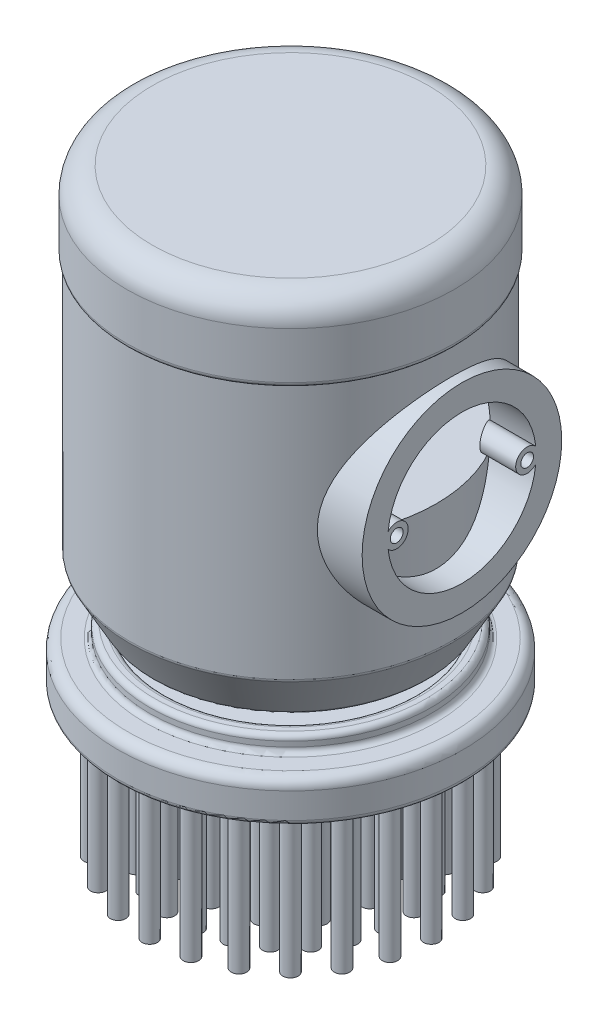
from build123d import *

# Parameters (mm, degrees)
SKETCH1_W                = 1.5
SKETCH1_H                = 3
SKETCH2_R                = 24.5
SKETCH2_R_2              = 13
CUT_EXTRUDE2_DEPTH       = 2
SKETCH5_R                = 19.5
BOSS_EXTRUDE3_DEPTH      = 33.5
SKETCH7_R                = 28.5
CUT_EXTRUDE3_DEPTH       = 43
SKETCH3_R                = 32
BOSS_EXTRUDE1_DEPTH      = 15
SKETCH4_R                = 1.5
BOSS_EXTRUDE2_DEPTH      = 29
FILLET1_R                = 5
FILLET2_R                = 1
FILLET3_R                = 2
CUT_EXTRUDE4_REACH       = 107.535
CUT_EXTRUDE4_END_RADIUS  = 28.5
SKETCH6_R                = 14.5
BOSS_EXTRUDE5_REACH      = 107.535
BOSS_EXTRUDE5_END_RADIUS = 28.5
SKETCH10_R               = 2.25
SKETCH10_R_2             = 1.25


with BuildPart() as part:
    # Sketch1 → Revolve1 (revolve)
    with BuildSketch(Plane.XY, mode=Mode.PRIVATE) as revolve1_sk:
        Polygon((1.5, 0), (26.5, 0), (31.5, 9), (31.5, 74), (0, 74), (0, 0), align=None)
        with Locations((0.75, -1.5)):
            Rectangle(SKETCH1_W, SKETCH1_H)
        Polygon((27.5, -3), (1.5, -3), (0, -3), (0, -6), (27.5, -6), align=None)
        Polygon((27.5, -6), (0, -6), (0, -14), (33.75, -14), (33.75, -6), align=None)
    revolve(revolve1_sk.sketch.rotate(Axis((0, 0, 0), (0, 1, 0)), 90), axis=Axis((0, 0, 0), (0, 1, 0)))

    # Sketch2 → Cut-Extrude2 (cut)
    with BuildSketch(Plane(origin=(0, -3, 0), x_dir=(1, 0, 0), z_dir=(0, 1, 0))):
        with Locations(Location((0, 0, 0), (0, 0, 270))):
            Circle(SKETCH2_R)
        with Locations(Location((0, 0, 0), (0, 0, 270))):
            Circle(SKETCH2_R_2, mode=Mode.SUBTRACT)
    extrude(amount=-CUT_EXTRUDE2_DEPTH, mode=Mode.SUBTRACT)

    # Sketch5 → Boss-Extrude3 (add)
    with BuildSketch(Plane(origin=(0, 0, 0), x_dir=(0, 0, -1), z_dir=(1, 0, 0))):
        with Locations(Location((0, 34.5, 0), (0, 0, 180))):
            Circle(SKETCH5_R)
    extrude(amount=BOSS_EXTRUDE3_DEPTH)

    # Sketch7 → Cut-Extrude3 (cut)
    with BuildSketch(Plane(origin=(0, 74, 0), x_dir=(1, 0, 0), z_dir=(0, 1, 0))):
        with Locations(Location((0, 0, 0), (0, 0, 270))):
            Circle(SKETCH7_R)
    extrude(amount=-CUT_EXTRUDE3_DEPTH, mode=Mode.SUBTRACT)

    # Sketch3 → Boss-Extrude1 (add)
    with BuildSketch(Plane(origin=(0, 74, 0), x_dir=(1, 0, 0), z_dir=(0, 1, 0))):
        with Locations(Location((0, 0, 0), (0, 0, 270))):
            Circle(SKETCH3_R)
    extrude(amount=-BOSS_EXTRUDE1_DEPTH)

    # Sketch4 → Boss-Extrude2 (add)
    with BuildSketch(Plane.XZ.offset(14)):
        with Locations(Location((27.5, 0, 0), (0, 0, 90))):
            Circle(SKETCH4_R)
        with Locations(Location((26.562960223, 7.11752374, 0), (0, 0, 90))):
            Circle(SKETCH4_R)
        with Locations(Location((23.815698604, 13.75, 0), (0, 0, 90))):
            Circle(SKETCH4_R)
        with Locations(Location((19.445436483, 19.445436483, 0), (0, 0, 90))):
            Circle(SKETCH4_R)
        with Locations(Location((13.75, 23.815698604, 0), (0, 0, 90))):
            Circle(SKETCH4_R)
        with Locations(Location((7.11752374, 26.562960223, 0), (0, 0, 90))):
            Circle(SKETCH4_R)
        with Locations(Location((0, 27.5, 0), (0, 0, 90))):
            Circle(SKETCH4_R)
        with Locations(Location((-7.11752374, 26.562960223, 0), (0, 0, 90))):
            Circle(SKETCH4_R)
        with Locations(Location((-13.75, 23.815698604, 0), (0, 0, 90))):
            Circle(SKETCH4_R)
        with Locations(Location((-19.445436483, 19.445436483, 0), (0, 0, 90))):
            Circle(SKETCH4_R)
        with Locations(Location((-23.815698604, 13.75, 0), (0, 0, 90))):
            Circle(SKETCH4_R)
        with Locations(Location((-26.562960223, 7.11752374, 0), (0, 0, 90))):
            Circle(SKETCH4_R)
        with Locations(Location((-27.5, 0, 0), (0, 0, 90))):
            Circle(SKETCH4_R)
        with Locations(Location((-26.562960223, -7.11752374, 0), (0, 0, 90))):
            Circle(SKETCH4_R)
        with Locations(Location((-23.815698604, -13.75, 0), (0, 0, 90))):
            Circle(SKETCH4_R)
        with Locations(Location((-19.445436483, -19.445436483, 0), (0, 0, 90))):
            Circle(SKETCH4_R)
        with Locations(Location((-13.75, -23.815698604, 0), (0, 0, 90))):
            Circle(SKETCH4_R)
        with Locations(Location((0, -27.5, 0), (0, 0, 90))):
            Circle(SKETCH4_R)
        with Locations(Location((7.11752374, -26.562960223, 0), (0, 0, 90))):
            Circle(SKETCH4_R)
        with Locations(Location((13.75, -23.815698604, 0), (0, 0, 90))):
            Circle(SKETCH4_R)
        with Locations(Location((19.445436483, -19.445436483, 0), (0, 0, 90))):
            Circle(SKETCH4_R)
        with Locations(Location((23.815698604, -13.75, 0), (0, 0, 90))):
            Circle(SKETCH4_R)
        with Locations(Location((26.562960223, -7.11752374, 0), (0, 0, 90))):
            Circle(SKETCH4_R)
        with Locations(Location((-2.806313133, 21.31606452, 0), (0, 0, 90))):
            Circle(SKETCH4_R)
        with Locations(Location((-8.227693796, 19.863409949, 0), (0, 0, 90))):
            Circle(SKETCH4_R)
        with Locations(Location((-13.088370724, 17.057096816, 0), (0, 0, 90))):
            Circle(SKETCH4_R)
        with Locations(Location((-17.057096816, 13.088370724, 0), (0, 0, 90))):
            Circle(SKETCH4_R)
        with Locations(Location((-19.863409949, 8.227693796, 0), (0, 0, 90))):
            Circle(SKETCH4_R)
        with Locations(Location((-21.31606452, 2.806313133, 0), (0, 0, 90))):
            Circle(SKETCH4_R)
        with Locations(Location((-21.31606452, -2.806313133, 0), (0, 0, 90))):
            Circle(SKETCH4_R)
        with Locations(Location((-19.863409949, -8.227693796, 0), (0, 0, 90))):
            Circle(SKETCH4_R)
        with Locations(Location((-17.057096816, -13.088370724, 0), (0, 0, 90))):
            Circle(SKETCH4_R)
        with Locations(Location((-13.088370724, -17.057096816, 0), (0, 0, 90))):
            Circle(SKETCH4_R)
        with Locations(Location((-8.227693796, -19.863409949, 0), (0, 0, 90))):
            Circle(SKETCH4_R)
        with Locations(Location((-2.806313133, -21.31606452, 0), (0, 0, 90))):
            Circle(SKETCH4_R)
        with Locations(Location((2.806313133, -21.31606452, 0), (0, 0, 90))):
            Circle(SKETCH4_R)
        with Locations(Location((8.227693796, -19.863409949, 0), (0, 0, 90))):
            Circle(SKETCH4_R)
        with Locations(Location((17.057096816, -13.088370724, 0), (0, 0, 90))):
            Circle(SKETCH4_R)
        with Locations(Location((21.31606452, -2.806313133, 0), (0, 0, 90))):
            Circle(SKETCH4_R)
        with Locations(Location((21.31606452, 2.806313133, 0), (0, 0, 90))):
            Circle(SKETCH4_R)
        with Locations(Location((19.863409949, 8.227693796, 0), (0, 0, 90))):
            Circle(SKETCH4_R)
        with Locations(Location((8.227693796, 19.863409949, 0), (0, 0, 90))):
            Circle(SKETCH4_R)
        with BuildLine():
            ThreePointArc((4.306313133, 21.31606452), (2.904417827, 22.812852904), (1.319145841, 21.511853808))
            Line((1.319145841, 21.511853808), (2.806313133, 21.31606452))
            Line((2.806313133, 21.31606452), (4.293480425, 21.120275231))
            ThreePointArc((4.293480425, 21.120275231), (4.303101518, 21.217959826), (4.306313133, 21.31606452))
        make_face()
        with BuildLine():
            Line((2.806313133, 21.31606452), (1.319145841, 21.511853808))
            ThreePointArc((1.319145841, 21.511853808), (2.610523844, 19.828897227), (4.293480425, 21.120275231))
            Line((4.293480425, 21.120275231), (2.806313133, 21.31606452))
        make_face()
        with Locations(Location((0, 15.5, 0), (0, 0, 90))):
            Circle(SKETCH4_R)
        with Locations(Location((4.011695199, 14.971850307, 0), (0, 0, 90))):
            Circle(SKETCH4_R)
        with Locations(Location((7.75, 13.423393759, 0), (0, 0, 90))):
            Circle(SKETCH4_R)
        with Locations(Location((10.960155108, 10.960155108, 0), (0, 0, 90))):
            Circle(SKETCH4_R)
        with Locations(Location((13.423393759, 7.75, 0), (0, 0, 90))):
            Circle(SKETCH4_R)
        with Locations(Location((14.971850307, 4.011695199, 0), (0, 0, 90))):
            Circle(SKETCH4_R)
        with Locations(Location((15.5, 0, 0), (0, 0, 90))):
            Circle(SKETCH4_R)
        with Locations(Location((14.971850307, -4.011695199, 0), (0, 0, 90))):
            Circle(SKETCH4_R)
        with Locations(Location((13.423393759, -7.75, 0), (0, 0, 90))):
            Circle(SKETCH4_R)
        with Locations(Location((10.960155108, -10.960155108, 0), (0, 0, 90))):
            Circle(SKETCH4_R)
        with Locations(Location((4.011695199, -14.971850307, 0), (0, 0, 90))):
            Circle(SKETCH4_R)
        with Locations(Location((0, -15.5, 0), (0, 0, 90))):
            Circle(SKETCH4_R)
        with Locations(Location((-4.011695199, -14.971850307, 0), (0, 0, 90))):
            Circle(SKETCH4_R)
        with Locations(Location((-7.75, -13.423393759, 0), (0, 0, 90))):
            Circle(SKETCH4_R)
        with Locations(Location((-10.960155108, -10.960155108, 0), (0, 0, 90))):
            Circle(SKETCH4_R)
        with Locations(Location((-13.423393759, -7.75, 0), (0, 0, 90))):
            Circle(SKETCH4_R)
        with Locations(Location((-14.971850307, -4.011695199, 0), (0, 0, 90))):
            Circle(SKETCH4_R)
        with Locations(Location((-15.5, 0, 0), (0, 0, 90))):
            Circle(SKETCH4_R)
        with Locations(Location((-4.011695199, 14.971850307, 0), (0, 0, 90))):
            Circle(SKETCH4_R)
        with Locations(Location((-7.75, 13.423393759, 0), (0, 0, 90))):
            Circle(SKETCH4_R)
        with Locations(Location((-10.960155108, 10.960155108, 0), (0, 0, 90))):
            Circle(SKETCH4_R)
        with Locations(Location((-13.423393759, 7.75, 0), (0, 0, 90))):
            Circle(SKETCH4_R)
        with Locations(Location((-14.971850307, 4.011695199, 0), (0, 0, 90))):
            Circle(SKETCH4_R)
        with Locations(Location((-7.11752374, -26.562960223, 0), (0, 0, 90))):
            Circle(SKETCH4_R)
        with Locations(Location((13.088370724, -17.057096816, 0), (0, 0, 90))):
            Circle(SKETCH4_R)
        with Locations(Location((19.863409949, -8.227693796, 0), (0, 0, 90))):
            Circle(SKETCH4_R)
        with Locations(Location((17.057096816, 13.088370724, 0), (0, 0, 90))):
            Circle(SKETCH4_R)
        with Locations(Location((13.088370724, 17.057096816, 0), (0, 0, 90))):
            Circle(SKETCH4_R)
        with Locations(Location((7.75, -13.423393759, 0), (0, 0, 90))):
            Circle(SKETCH4_R)
    extrude(amount=BOSS_EXTRUDE2_DEPTH)

    # Fillet1
    fillet1_edges = [part.edges().sort_by_distance(p)[0] for p in [
        (0, 74, -32),
    ]]
    fillet(fillet1_edges, radius=FILLET1_R)

    # Fillet2
    # the kernel refuses this fillet: 1 mm, written as the material it adds along each edge
    with BuildSketch(Plane(origin=(0, -6, 0), x_dir=(0, 0, -1), z_dir=(1, 0, 0))) as fillet2_piece_1:
        with BuildLine():
            CenterArc((27.5 + FILLET2_R, FILLET2_R), FILLET2_R, 180, 90)
            Line((27.5 + FILLET2_R, 0), (27.5, 0))
            Line((27.5, 0), (27.5, FILLET2_R))
        make_face()
    revolve(axis=Axis((0, -6, 0), (0, 1, 0)))
    # the kernel refuses this fillet: 1 mm, written as the material it takes off along each edge
    with BuildSketch(Plane(origin=(0, 0, 0), x_dir=(0, 0, -1), z_dir=(1, 0, 0))) as fillet2_2_piece_1:
        with BuildLine():
            CenterArc((26.5 - FILLET2_R * 0.588403348999, FILLET2_R), FILLET2_R, 270, 60.945395901)
            Line((26.5 - FILLET2_R * 0.588403348999, 0), (26.5, 0))
            Line((26.5, 0), (26.5 + FILLET2_R * 0.285753927123, FILLET2_R * 0.514357068821))
        make_face()
    revolve(axis=Axis((0, 0, 0), (0, 1, 0)), mode=Mode.SUBTRACT)
    with BuildSketch(Plane(origin=(0, -3, 0), x_dir=(0, 0, -1), z_dir=(1, 0, 0))) as fillet2_2_piece_2:
        with BuildLine():
            CenterArc((27.5 - FILLET2_R, -FILLET2_R), FILLET2_R, 0, 90)
            Line((27.5, -FILLET2_R), (27.5, 0))
            Line((27.5, 0), (27.5 - FILLET2_R, 0))
        make_face()
    revolve(axis=Axis((0, -3, 0), (0, 1, 0)), mode=Mode.SUBTRACT)
    with BuildSketch(Plane(origin=(0, -14, 0), x_dir=(0, 0, -1), z_dir=(1, 0, 0))) as fillet2_2_piece_3:
        with BuildLine():
            CenterArc((33.75 - FILLET2_R, FILLET2_R), FILLET2_R, 270, 90)
            Line((33.75 - FILLET2_R, 0), (33.75, 0))
            Line((33.75, 0), (33.75, FILLET2_R))
        make_face()
    revolve(axis=Axis((0, -14, 0), (0, 1, 0)), mode=Mode.SUBTRACT)
    with BuildSketch(Plane(origin=(0, 9, 0), x_dir=(0, 0, -1), z_dir=(1, 0, 0))) as fillet2_2_piece_4:
        with BuildLine():
            CenterArc((31.5 - FILLET2_R, FILLET2_R * 0.259126028197), FILLET2_R, 330.945395901, 29.054604099)
            Line((31.5 - FILLET2_R * 0.125842723878, -FILLET2_R * 0.226516902981), (31.5, 0))
            Line((31.5, 0), (31.5, FILLET2_R * 0.259126028197))
        make_face()
    revolve(axis=Axis((0, 9, 0), (0, 1, 0)), mode=Mode.SUBTRACT)
    with BuildSketch(Plane(origin=(0, -3, 0), x_dir=(0, 0, 1), z_dir=(-1, 0, 0))) as fillet2_2_piece_5:
        with BuildLine():
            CenterArc((24.5 + FILLET2_R, -FILLET2_R), FILLET2_R, 90, 90)
            Line((24.5 + FILLET2_R, 0), (24.5, 0))
            Line((24.5, 0), (24.5, -FILLET2_R))
        make_face()
    revolve(axis=Axis((0, -3, 0), (0, 1, 0)), mode=Mode.SUBTRACT)
    with BuildSketch(Plane(origin=(0, 59, 0), x_dir=(0, 0, 1), z_dir=(-1, 0, 0))) as fillet2_2_piece_6:
        with BuildLine():
            CenterArc((31, 0.866025404), FILLET2_R, 300, 60)
            Line((31.5, 0), (32, 0))
            Line((32, 0), (32, 0.866025404))
        make_face()
    revolve(axis=Axis((0, 59, 0), (0, 1, 0)), mode=Mode.SUBTRACT)

    # Fillet3
    fillet3_edges = [part.edges().sort_by_distance(p)[0] for p in [
        (0, -6, 33.75),
    ]]
    fillet(fillet3_edges, radius=FILLET3_R)

    # Cut-Extrude4: up to this cylinder (the profile starts outside it)
    cut_extrude4_end = Plane(origin=(0, 34.5, 0), z_dir=(0, 1, 0)) * Cylinder(CUT_EXTRUDE4_END_RADIUS, 273.07, mode=Mode.PRIVATE)
    # Sketch6 → Cut-Extrude4 (cut, up to the surface)
    with BuildSketch(Plane(origin=(33.5, 0, 0), x_dir=(0, 0, -1), z_dir=(1, 0, 0)), mode=Mode.PRIVATE) as cut_extrude4_sk1:
        with Locations((0, 34.5)):
            Circle(SKETCH6_R)
    cut_extrude4_tool1 = extrude(cut_extrude4_sk1.sketch, amount=-CUT_EXTRUDE4_REACH, mode=Mode.PRIVATE) - cut_extrude4_end
    add(cut_extrude4_tool1.solids().sort_by_distance((33.5, 34.5, 0))[0], mode=Mode.SUBTRACT)

    # Boss-Extrude5: up to this cylinder (the profile starts outside it)
    boss_extrude5_end = Plane(origin=(0, 34.5, 0), z_dir=(0, 1, 0)) * Cylinder(BOSS_EXTRUDE5_END_RADIUS, 273.07, mode=Mode.PRIVATE)
    # Sketch10 → Boss-Extrude5 (add, up to the surface)
    with BuildSketch(Plane(origin=(33.5, 0, 0), x_dir=(0, 0, -1), z_dir=(1, 0, 0)), mode=Mode.PRIVATE) as boss_extrude5_sk1:
        with Locations((-12.75, 34.5)):
            Circle(SKETCH10_R)
        with Locations((-12.75, 34.5)):
            Circle(SKETCH10_R_2, mode=Mode.SUBTRACT)
    boss_extrude5_tool1 = extrude(boss_extrude5_sk1.sketch, amount=-BOSS_EXTRUDE5_REACH, mode=Mode.PRIVATE) - boss_extrude5_end
    add(boss_extrude5_tool1.solids().sort_by_distance((33.5, 34.5, 14.93636))[0])
    # Sketch10 → Boss-Extrude5 (add, up to the surface)
    with BuildSketch(Plane(origin=(33.5, 0, 0), x_dir=(0, 0, -1), z_dir=(1, 0, 0)), mode=Mode.PRIVATE) as boss_extrude5_sk2:
        with Locations((12.75, 34.5)):
            Circle(SKETCH10_R)
        with Locations((12.75, 34.5)):
            Circle(SKETCH10_R_2, mode=Mode.SUBTRACT)
    boss_extrude5_tool2 = extrude(boss_extrude5_sk2.sketch, amount=-BOSS_EXTRUDE5_REACH, mode=Mode.PRIVATE) - boss_extrude5_end
    add(boss_extrude5_tool2.solids().sort_by_distance((33.5, 34.5, -10.56364))[0])


solid = part.part
